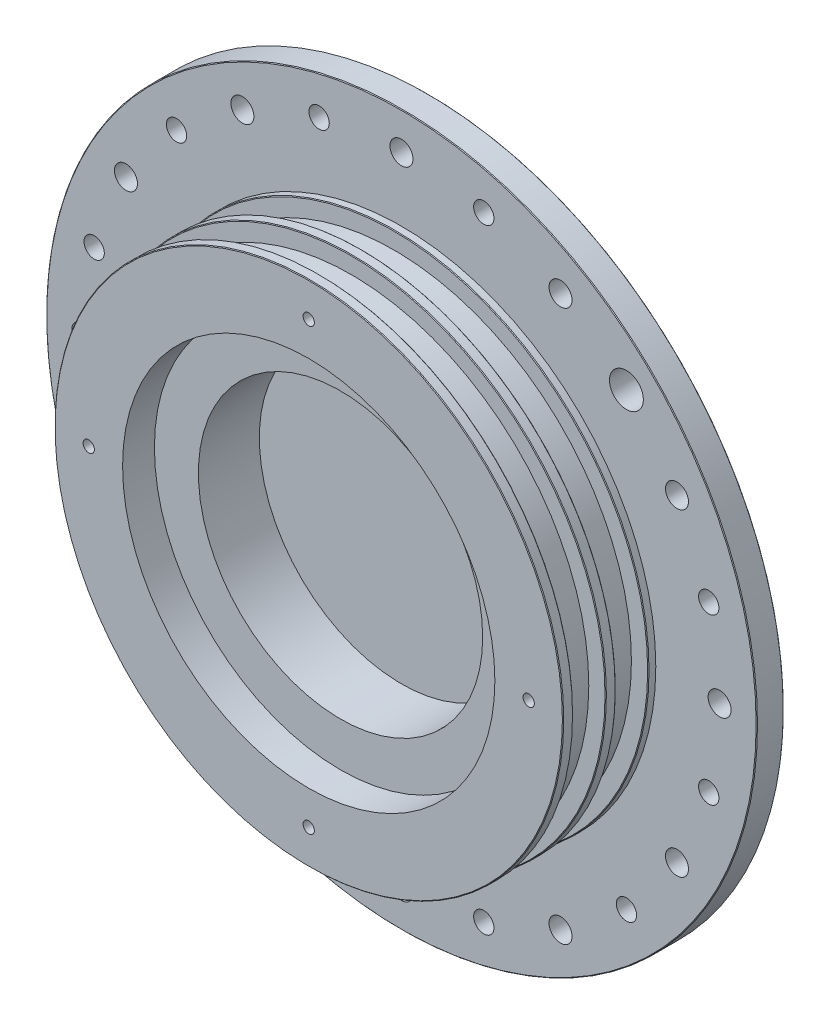
from build123d import *

# Parameters (mm, degrees)
DIAM_TRE_DU_PER_AGE_9_0_9_1_D     = 9
DIAM_TRE_DU_PER_AGE_9_0_9_1_DEPTH = 3
D_GAGEMENT_M31_D                  = 3.332
D_GAGEMENT_M31_DEPTH              = 16
D_GAGEMENT_M31_TIP                = 1.001033791
D_GAGEMENT_M1001_D                = 110
D_GAGEMENT_M1001_DEPTH            = 27.4
ESQUISSE8_R                       = 105
ESQUISSE8_R_2                     = 77.5
BOSS_EXTRU_1_DEPTH                = 8
ESQUISSE9_R                       = 3.4
ENL_V_MAT_EXTRU_1_DEPTH           = 20
ENL_V_MAT_EXTRU_15_DEPTH          = 153.653725798
ENL_V_MAT_EXTRU_15_DEPTH_BACK     = 153.653725798
ESQUISSE24_R                      = 3
ESQUISSE24_R_2                    = 5
CHANFREIN1_SIZE                   = 0.2
ESQUISSE25_R                      = 9.2
ENL_V_MAT_EXTRU_18_DEPTH          = 2
ESQUISSE35_R                      = 55
ESQUISSE35_R_2                    = 42
BOSS_EXTRU_4_DEPTH                = 18
BOSS_EXTRU_5_START                = -4
ESQUISSE36_R                      = 5
BOSS_EXTRU_5_DEPTH                = 4
ESQUISSE9_2_R                     = 3.4
ENL_V_MAT_EXTRU_20_DEPTH          = 20


with BuildPart() as part:
    # Esquisse1 → Révolution1 (revolve)
    with BuildSketch(Plane(origin=(0, 0, 0), x_dir=(1, 0, 0), z_dir=(0, 1, 0))):
        Polygon((87.5, 35.4), (0, 35.4), (0, 0), (75.15, 0), (75.15, 3), (70.15, 3), (70.15, 12.6), (75.15, 12.6), (75.15, 15.6), (70.15, 15.6), (70.15, 25.2), (75.15, 25.2), (75.15, 27.4), (87.5, 27.4), align=None)
    revolve(axis=Axis((0, 0, -35.4), (0, 0, 1)))

    # Diamètre du perçage Ø9.0 (9)1
    with Locations(Plane.XY.offset(-27.4)):
        with Locations((-87.5, 0), (0, 87.5), (0, -87.5), (87.5, 0)):
            Hole(DIAM_TRE_DU_PER_AGE_9_0_9_1_D / 2, depth=DIAM_TRE_DU_PER_AGE_9_0_9_1_DEPTH)

    # Dégagement M31
    with Locations(Plane.XY):
        with Locations((-65, 0), (65, 0), (0, 65), (0, -65)):
            Hole(D_GAGEMENT_M31_D / 2, depth=D_GAGEMENT_M31_DEPTH)
            with Locations((0, 0, -(D_GAGEMENT_M31_DEPTH + D_GAGEMENT_M31_TIP / 2))):  # 118° drill point
                Cone(0, D_GAGEMENT_M31_D / 2, D_GAGEMENT_M31_TIP, mode=Mode.SUBTRACT)

    # Dégagement M1001
    with Locations(Plane.XY):
        with Locations((0, 0)):
            Hole(D_GAGEMENT_M1001_D / 2, depth=D_GAGEMENT_M1001_DEPTH)

    # Esquisse8 → Boss.-Extru.1 (add)
    with BuildSketch(Plane(origin=(0, 0, -35.4), x_dir=(-1, 0, 0), z_dir=(0, 0, -1))):
        Circle(ESQUISSE8_R)
        Circle(ESQUISSE8_R_2, mode=Mode.SUBTRACT)
    extrude(amount=-BOSS_EXTRU_1_DEPTH)

    # Esquisse9 → Enlèv. mat.-Extru.1 (cut)
    with BuildSketch(Plane.XY.offset(-35.4)):
        with Locations((0, -50)):
            Circle(ESQUISSE9_R)
        with Locations((0, -94)):
            Circle(ESQUISSE9_R)
        with Locations((-25, -43.301270189)):
            Circle(ESQUISSE9_R)
        with Locations((-47, -81.406387956)):
            Circle(ESQUISSE9_R)
        with Locations((-43.301270189, -25)):
            Circle(ESQUISSE9_R)
        with Locations((-81.406387956, -47)):
            Circle(ESQUISSE9_R)
        with Locations((-50, 0)):
            Circle(ESQUISSE9_R)
        with Locations((-94, 0)):
            Circle(ESQUISSE9_R)
        with Locations((-43.301270189, 25)):
            Circle(ESQUISSE9_R)
        with Locations((-81.406387956, 47)):
            Circle(ESQUISSE9_R)
        with Locations((-25, 43.301270189)):
            Circle(ESQUISSE9_R)
        with Locations((-47, 81.406387956)):
            Circle(ESQUISSE9_R)
        with Locations((0, 50)):
            Circle(ESQUISSE9_R)
        with Locations((0, 94)):
            Circle(ESQUISSE9_R)
        with Locations((25, 43.301270189)):
            Circle(ESQUISSE9_R)
        with Locations((47, 81.406387956)):
            Circle(ESQUISSE9_R)
        with Locations((43.301270189, 25)):
            Circle(ESQUISSE9_R)
        with Locations((81.406387956, 47)):
            Circle(ESQUISSE9_R)
        with Locations((50, 0)):
            Circle(ESQUISSE9_R)
        with Locations((94, 0)):
            Circle(ESQUISSE9_R)
        with Locations((43.301270189, -25)):
            Circle(ESQUISSE9_R)
        with Locations((81.406387956, -47)):
            Circle(ESQUISSE9_R)
        with Locations((25, -43.301270189)):
            Circle(ESQUISSE9_R)
        with Locations((47, -81.406387956)):
            Circle(ESQUISSE9_R)
    extrude(amount=ENL_V_MAT_EXTRU_1_DEPTH, mode=Mode.SUBTRACT)

    # Esquisse24 → Enlèv. mat.-Extru.15 (cut, two sides: drawn at the far end of the back side and taken through both)
    with BuildSketch(Plane(origin=(0, 0, -35.4), x_dir=(-1, 0, 0), z_dir=(0, 0, -1)).offset(-ENL_V_MAT_EXTRU_15_DEPTH_BACK)):
        with Locations((24.32899024, 90.797027671)):
            Circle(ESQUISSE24_R)
        with Locations((66.468037432, 66.468037432)):
            Circle(ESQUISSE24_R)
        with Locations((90.797027671, 24.32899024)):
            Circle(ESQUISSE24_R)
        with Locations((90.797027671, -24.32899024)):
            Circle(ESQUISSE24_R)
        with Locations((-14, 24.248711306)):
            Circle(ESQUISSE24_R_2)
        with Locations((7.246933263, 27.045923136)):
            Circle(ESQUISSE24_R_2)
        with Locations((24.248711306, 14)):
            Circle(ESQUISSE24_R_2)
        with Locations((27.045923136, -7.246933263)):
            Circle(ESQUISSE24_R_2)
        with Locations((14, -24.248711306)):
            Circle(ESQUISSE24_R_2)
        with Locations((-7.246933263, -27.045923136)):
            Circle(ESQUISSE24_R_2)
        with Locations((-24.248711306, -14)):
            Circle(ESQUISSE24_R_2)
        with Locations((-27.045923136, 7.246933263)):
            Circle(ESQUISSE24_R_2)
        with Locations((-66.468037432, 66.468037432)):
            Circle(ESQUISSE24_R_2)
        with Locations((66.468037432, -66.468037432)):
            Circle(ESQUISSE24_R)
        with Locations((24.32899024, -90.797027671)):
            Circle(ESQUISSE24_R)
        with Locations((-24.32899024, -90.797027671)):
            Circle(ESQUISSE24_R)
        with Locations((-66.468037432, -66.468037432)):
            Circle(ESQUISSE24_R)
        with Locations((-90.797027671, -24.32899024)):
            Circle(ESQUISSE24_R)
        with Locations((-90.797027671, 24.32899024)):
            Circle(ESQUISSE24_R)
        with Locations((-24.32899024, 90.797027671)):
            Circle(ESQUISSE24_R)
        Circle(ESQUISSE24_R_2)
    extrude(amount=ENL_V_MAT_EXTRU_15_DEPTH + ENL_V_MAT_EXTRU_15_DEPTH_BACK, mode=Mode.SUBTRACT)

    # Chanfrein1
    chanfrein1_edges = [part.edges().sort_by_distance(p)[0] for p in [
        (-75.15, 0, -25.2),
        (-75.15, 0, -3),
        (-75.15, 0, -12.6),
        (-75.15, 0, -15.6),
        (105, 0, -35.4),
        (105, 0, -27.4),
        (-75.15, 0, 0),
    ]]
    chamfer(chanfrein1_edges, length=CHANFREIN1_SIZE)

    # Esquisse25 → Enlèv. mat.-Extru.18 (cut)
    with BuildSketch(Plane(origin=(0, 0, -35.4), x_dir=(-1, 0, 0), z_dir=(0, 0, -1))):
        Circle(ESQUISSE25_R)
        with BuildLine():
            Line((-22.534674305, 14.423884843), (-27.364303436, 15.717980069))
            ThreePointArc((-27.364303436, 15.717980069), (-27.626062148, 15.80113362), (-27.879119212, 15.907877515))
            ThreePointArc((-27.879119212, 15.907877515), (-29.43732897, 16.188098003), (-30.921195595, 15.636118826))
            ThreePointArc((-30.921195595, 15.636118826), (-31.100803738, 15.516590499), (-31.288537773, 15.410279455))
            ThreePointArc((-31.288537773, 15.410279455), (-35.932440738, 9.628068478), (-34.801808286, 2.298575399))
            ThreePointArc((-34.801808286, 2.298575399), (-34.692381365, 2.112640317), (-34.596600313, 1.919321678))
            ThreePointArc((-34.596600313, 1.919321678), (-33.587523709, 0.699360376), (-32.09796423, 0.162933558))
            ThreePointArc((-32.09796423, 0.162933558), (-31.825438437, 0.128847951), (-31.557171967, 0.069981683))
            Line((-31.557171967, 0.069981683), (-26.727542836, -1.224113543))
            ThreePointArc((-26.727542836, -1.224113543), (-26.465784124, -1.307267094), (-26.212727061, -1.414010989))
            ThreePointArc((-26.212727061, -1.414010989), (-24.654517302, -1.694231477), (-23.170650678, -1.1422523))
            ThreePointArc((-23.170650678, -1.1422523), (-22.991042534, -1.022723973), (-22.803308499, -0.916412929))
            ThreePointArc((-22.803308499, -0.916412929), (-18.159405534, 4.865798048), (-19.290037986, 12.195291126))
            ThreePointArc((-19.290037986, 12.195291126), (-19.399464908, 12.381226209), (-19.495245959, 12.574544848))
            ThreePointArc((-19.495245959, 12.574544848), (-20.504322564, 13.79450615), (-21.993882042, 14.330932968))
            ThreePointArc((-21.993882042, 14.330932968), (-22.266407835, 14.365018575), (-22.534674305, 14.423884843))
        make_face()
        with BuildLine():
            Line((-5.735194229, 26.133647797), (-8.235194229, 30.463774815))
            ThreePointArc((-8.235194229, 30.463774815), (-8.36148715, 30.707664616), (-8.464946183, 30.962082313))
            ThreePointArc((-8.464946183, 30.962082313), (-9.368621062, 32.262048807), (-10.808181434, 32.92099274))
            ThreePointArc((-10.808181434, 32.92099274), (-11.019702861, 32.963475586), (-11.22762413, 33.021050335))
            ThreePointArc((-11.22762413, 33.021050335), (-18.6, 32.216145021), (-22.983256384, 26.233932888))
            ThreePointArc((-22.983256384, 26.233932888), (-23.037355824, 26.025080413), (-23.106325314, 25.820656061))
            ThreePointArc((-23.106325314, 25.820656061), (-23.255443313, 24.244488242), (-22.581476746, 22.811899593))
            ThreePointArc((-22.581476746, 22.811899593), (-22.412874073, 22.595092593), (-22.264805771, 22.363774815))
            Line((-22.264805771, 22.363774815), (-19.764805771, 18.033647797))
            ThreePointArc((-19.764805771, 18.033647797), (-19.63851285, 17.789757996), (-19.535053817, 17.535340299))
            ThreePointArc((-19.535053817, 17.535340299), (-18.631378938, 16.235373805), (-17.191818566, 15.576429871))
            ThreePointArc((-17.191818566, 15.576429871), (-16.980297139, 15.533947026), (-16.77237587, 15.476372277))
            ThreePointArc((-16.77237587, 15.476372277), (-9.4, 16.281277591), (-5.016743616, 22.263489724))
            ThreePointArc((-5.016743616, 22.263489724), (-4.962644176, 22.472342199), (-4.893674686, 22.676766551))
            ThreePointArc((-4.893674686, 22.676766551), (-4.744556687, 24.25293437), (-5.418523254, 25.685523019))
            ThreePointArc((-5.418523254, 25.685523019), (-5.587125927, 25.902330019), (-5.735194229, 26.133647797))
        make_face()
        with BuildLine():
            Line((14.423884843, 22.534674305), (15.717980069, 27.364303436))
            ThreePointArc((15.717980069, 27.364303436), (15.80113362, 27.626062148), (15.907877515, 27.879119212))
            ThreePointArc((15.907877515, 27.879119212), (16.188098003, 29.43732897), (15.636118826, 30.921195595))
            ThreePointArc((15.636118826, 30.921195595), (15.516590499, 31.100803738), (15.410279455, 31.288537773))
            ThreePointArc((15.410279455, 31.288537773), (9.628068478, 35.932440738), (2.298575399, 34.801808286))
            ThreePointArc((2.298575399, 34.801808286), (2.112640317, 34.692381365), (1.919321678, 34.596600313))
            ThreePointArc((1.919321678, 34.596600313), (0.699360376, 33.587523709), (0.162933558, 32.09796423))
            ThreePointArc((0.162933558, 32.09796423), (0.128847951, 31.825438437), (0.069981683, 31.557171967))
            Line((0.069981683, 31.557171967), (-1.224113543, 26.727542836))
            ThreePointArc((-1.224113543, 26.727542836), (-1.307267094, 26.465784124), (-1.414010989, 26.212727061))
            ThreePointArc((-1.414010989, 26.212727061), (-1.694231477, 24.654517302), (-1.1422523, 23.170650678))
            ThreePointArc((-1.1422523, 23.170650678), (-1.022723973, 22.991042534), (-0.916412929, 22.803308499))
            ThreePointArc((-0.916412929, 22.803308499), (4.865798048, 18.159405534), (12.195291126, 19.290037986))
            ThreePointArc((12.195291126, 19.290037986), (12.381226209, 19.399464908), (12.574544848, 19.495245959))
            ThreePointArc((12.574544848, 19.495245959), (13.79450615, 20.504322564), (14.330932968, 21.993882042))
            ThreePointArc((14.330932968, 21.993882042), (14.365018575, 22.266407835), (14.423884843, 22.534674305))
        make_face()
        with BuildLine():
            Line((26.133647797, 5.735194229), (30.463774815, 8.235194229))
            ThreePointArc((30.463774815, 8.235194229), (30.707664616, 8.36148715), (30.962082313, 8.464946183))
            ThreePointArc((30.962082313, 8.464946183), (32.262048807, 9.368621062), (32.92099274, 10.808181434))
            ThreePointArc((32.92099274, 10.808181434), (32.963475586, 11.019702861), (33.021050335, 11.22762413))
            ThreePointArc((33.021050335, 11.22762413), (32.216145021, 18.6), (26.233932888, 22.983256384))
            ThreePointArc((26.233932888, 22.983256384), (26.025080413, 23.037355824), (25.820656061, 23.106325314))
            ThreePointArc((25.820656061, 23.106325314), (24.244488242, 23.255443313), (22.811899593, 22.581476746))
            ThreePointArc((22.811899593, 22.581476746), (22.595092593, 22.412874073), (22.363774815, 22.264805771))
            Line((22.363774815, 22.264805771), (18.033647797, 19.764805771))
            ThreePointArc((18.033647797, 19.764805771), (17.789757996, 19.63851285), (17.535340299, 19.535053817))
            ThreePointArc((17.535340299, 19.535053817), (16.235373805, 18.631378938), (15.576429871, 17.191818566))
            ThreePointArc((15.576429871, 17.191818566), (15.533947026, 16.980297139), (15.476372277, 16.77237587))
            ThreePointArc((15.476372277, 16.77237587), (16.281277591, 9.4), (22.263489724, 5.016743616))
            ThreePointArc((22.263489724, 5.016743616), (22.472342199, 4.962644176), (22.676766551, 4.893674686))
            ThreePointArc((22.676766551, 4.893674686), (24.25293437, 4.744556687), (25.685523019, 5.418523254))
            ThreePointArc((25.685523019, 5.418523254), (25.902330019, 5.587125927), (26.133647797, 5.735194229))
        make_face()
        with BuildLine():
            Line((22.534674305, -14.423884843), (27.364303436, -15.717980069))
            ThreePointArc((27.364303436, -15.717980069), (27.626062148, -15.80113362), (27.879119212, -15.907877515))
            ThreePointArc((27.879119212, -15.907877515), (29.43732897, -16.188098003), (30.921195595, -15.636118826))
            ThreePointArc((30.921195595, -15.636118826), (31.100803738, -15.516590499), (31.288537773, -15.410279455))
            ThreePointArc((31.288537773, -15.410279455), (35.932440738, -9.628068478), (34.801808286, -2.298575399))
            ThreePointArc((34.801808286, -2.298575399), (34.692381365, -2.112640317), (34.596600313, -1.919321678))
            ThreePointArc((34.596600313, -1.919321678), (33.587523709, -0.699360376), (32.09796423, -0.162933558))
            ThreePointArc((32.09796423, -0.162933558), (31.825438437, -0.128847951), (31.557171967, -0.069981683))
            Line((31.557171967, -0.069981683), (26.727542836, 1.224113543))
            ThreePointArc((26.727542836, 1.224113543), (26.465784124, 1.307267094), (26.212727061, 1.414010989))
            ThreePointArc((26.212727061, 1.414010989), (24.654517302, 1.694231477), (23.170650678, 1.1422523))
            ThreePointArc((23.170650678, 1.1422523), (22.991042534, 1.022723973), (22.803308499, 0.916412929))
            ThreePointArc((22.803308499, 0.916412929), (18.159405534, -4.865798048), (19.290037986, -12.195291126))
            ThreePointArc((19.290037986, -12.195291126), (19.399464908, -12.381226209), (19.495245959, -12.574544848))
            ThreePointArc((19.495245959, -12.574544848), (20.504322564, -13.79450615), (21.993882042, -14.330932968))
            ThreePointArc((21.993882042, -14.330932968), (22.266407835, -14.365018575), (22.534674305, -14.423884843))
        make_face()
        with BuildLine():
            Line((5.735194229, -26.133647797), (8.235194229, -30.463774815))
            ThreePointArc((8.235194229, -30.463774815), (8.36148715, -30.707664616), (8.464946183, -30.962082313))
            ThreePointArc((8.464946183, -30.962082313), (9.368621062, -32.262048807), (10.808181434, -32.92099274))
            ThreePointArc((10.808181434, -32.92099274), (11.019702861, -32.963475586), (11.22762413, -33.021050335))
            ThreePointArc((11.22762413, -33.021050335), (18.6, -32.216145021), (22.983256384, -26.233932888))
            ThreePointArc((22.983256384, -26.233932888), (23.037355824, -26.025080413), (23.106325314, -25.820656061))
            ThreePointArc((23.106325314, -25.820656061), (23.255443313, -24.244488242), (22.581476746, -22.811899593))
            ThreePointArc((22.581476746, -22.811899593), (22.412874073, -22.595092593), (22.264805771, -22.363774815))
            Line((22.264805771, -22.363774815), (19.764805771, -18.033647797))
            ThreePointArc((19.764805771, -18.033647797), (19.63851285, -17.789757996), (19.535053817, -17.535340299))
            ThreePointArc((19.535053817, -17.535340299), (18.631378938, -16.235373805), (17.191818566, -15.576429871))
            ThreePointArc((17.191818566, -15.576429871), (16.980297139, -15.533947026), (16.77237587, -15.476372277))
            ThreePointArc((16.77237587, -15.476372277), (9.4, -16.281277591), (5.016743616, -22.263489724))
            ThreePointArc((5.016743616, -22.263489724), (4.962644176, -22.472342199), (4.893674686, -22.676766551))
            ThreePointArc((4.893674686, -22.676766551), (4.744556687, -24.25293437), (5.418523254, -25.685523019))
            ThreePointArc((5.418523254, -25.685523019), (5.587125927, -25.902330019), (5.735194229, -26.133647797))
        make_face()
        with BuildLine():
            Line((-14.423884843, -22.534674305), (-15.717980069, -27.364303436))
            ThreePointArc((-15.717980069, -27.364303436), (-15.80113362, -27.626062148), (-15.907877515, -27.879119212))
            ThreePointArc((-15.907877515, -27.879119212), (-16.188098003, -29.43732897), (-15.636118826, -30.921195595))
            ThreePointArc((-15.636118826, -30.921195595), (-15.516590499, -31.100803738), (-15.410279455, -31.288537773))
            ThreePointArc((-15.410279455, -31.288537773), (-9.628068478, -35.932440738), (-2.298575399, -34.801808286))
            ThreePointArc((-2.298575399, -34.801808286), (-2.112640317, -34.692381365), (-1.919321678, -34.596600313))
            ThreePointArc((-1.919321678, -34.596600313), (-0.699360376, -33.587523709), (-0.162933558, -32.09796423))
            ThreePointArc((-0.162933558, -32.09796423), (-0.128847951, -31.825438437), (-0.069981683, -31.557171967))
            Line((-0.069981683, -31.557171967), (1.224113543, -26.727542836))
            ThreePointArc((1.224113543, -26.727542836), (1.307267094, -26.465784124), (1.414010989, -26.212727061))
            ThreePointArc((1.414010989, -26.212727061), (1.694231477, -24.654517302), (1.1422523, -23.170650678))
            ThreePointArc((1.1422523, -23.170650678), (1.022723973, -22.991042534), (0.916412929, -22.803308499))
            ThreePointArc((0.916412929, -22.803308499), (-4.865798048, -18.159405534), (-12.195291126, -19.290037986))
            ThreePointArc((-12.195291126, -19.290037986), (-12.381226209, -19.399464908), (-12.574544848, -19.495245959))
            ThreePointArc((-12.574544848, -19.495245959), (-13.79450615, -20.504322564), (-14.330932968, -21.993882042))
            ThreePointArc((-14.330932968, -21.993882042), (-14.365018575, -22.266407835), (-14.423884843, -22.534674305))
        make_face()
        with BuildLine():
            Line((-26.133647797, -5.735194229), (-30.463774815, -8.235194229))
            ThreePointArc((-30.463774815, -8.235194229), (-30.707664616, -8.36148715), (-30.962082313, -8.464946183))
            ThreePointArc((-30.962082313, -8.464946183), (-32.262048807, -9.368621062), (-32.92099274, -10.808181434))
            ThreePointArc((-32.92099274, -10.808181434), (-32.963475586, -11.019702861), (-33.021050335, -11.22762413))
            ThreePointArc((-33.021050335, -11.22762413), (-32.216145021, -18.6), (-26.233932888, -22.983256384))
            ThreePointArc((-26.233932888, -22.983256384), (-26.025080413, -23.037355824), (-25.820656061, -23.106325314))
            ThreePointArc((-25.820656061, -23.106325314), (-24.244488242, -23.255443313), (-22.811899593, -22.581476746))
            ThreePointArc((-22.811899593, -22.581476746), (-22.595092593, -22.412874073), (-22.363774815, -22.264805771))
            Line((-22.363774815, -22.264805771), (-18.033647797, -19.764805771))
            ThreePointArc((-18.033647797, -19.764805771), (-17.789757996, -19.63851285), (-17.535340299, -19.535053817))
            ThreePointArc((-17.535340299, -19.535053817), (-16.235373805, -18.631378938), (-15.576429871, -17.191818566))
            ThreePointArc((-15.576429871, -17.191818566), (-15.533947026, -16.980297139), (-15.476372277, -16.77237587))
            ThreePointArc((-15.476372277, -16.77237587), (-16.281277591, -9.4), (-22.263489724, -5.016743616))
            ThreePointArc((-22.263489724, -5.016743616), (-22.472342199, -4.962644176), (-22.676766551, -4.893674686))
            ThreePointArc((-22.676766551, -4.893674686), (-24.25293437, -4.744556687), (-25.685523019, -5.418523254))
            ThreePointArc((-25.685523019, -5.418523254), (-25.902330019, -5.587125927), (-26.133647797, -5.735194229))
        make_face()
    extrude(amount=-ENL_V_MAT_EXTRU_18_DEPTH, mode=Mode.SUBTRACT)

    # Esquisse35 → Boss.-Extru.4 (add)
    with BuildSketch(Plane.XY.offset(-27.4)):
        Circle(ESQUISSE35_R)
        Circle(ESQUISSE35_R_2, mode=Mode.SUBTRACT)
    extrude(amount=BOSS_EXTRU_4_DEPTH)

    # Esquisse36 → Boss.-Extru.5 (add)
    with BuildSketch(Plane.XY.offset(-27.4).offset(BOSS_EXTRU_5_START)):
        with Locations((-27.045923136, -7.246933263)):
            Circle(ESQUISSE36_R)
        with Locations((-24.248711306, 14)):
            Circle(ESQUISSE36_R)
        with Locations((-7.246933263, 27.045923136)):
            Circle(ESQUISSE36_R)
        with Locations((14, 24.248711306)):
            Circle(ESQUISSE36_R)
        with Locations((27.045923136, 7.246933263)):
            Circle(ESQUISSE36_R)
        with Locations((24.248711306, -14)):
            Circle(ESQUISSE36_R)
        with Locations((7.246933263, -27.045923136)):
            Circle(ESQUISSE36_R)
        with Locations((-14, -24.248711306)):
            Circle(ESQUISSE36_R)
        Circle(ESQUISSE36_R)
    extrude(amount=BOSS_EXTRU_5_DEPTH)

    # Esquisse9<2> → Enlèv. mat.-Extru.20 (cut)
    with BuildSketch(Plane.XY.offset(-35.4)):
        with Locations((0, -50)):
            Circle(ESQUISSE9_2_R)
        with Locations((0, -94)):
            Circle(ESQUISSE9_2_R)
        with Locations((-25, -43.301270189)):
            Circle(ESQUISSE9_2_R)
        with Locations((-47, -81.406387956)):
            Circle(ESQUISSE9_2_R)
        with Locations((-43.301270189, -25)):
            Circle(ESQUISSE9_2_R)
        with Locations((-81.406387956, -47)):
            Circle(ESQUISSE9_2_R)
        with Locations((-50, 0)):
            Circle(ESQUISSE9_2_R)
        with Locations((-94, 0)):
            Circle(ESQUISSE9_2_R)
        with Locations((-43.301270189, 25)):
            Circle(ESQUISSE9_2_R)
        with Locations((-81.406387956, 47)):
            Circle(ESQUISSE9_2_R)
        with Locations((-25, 43.301270189)):
            Circle(ESQUISSE9_2_R)
        with Locations((-47, 81.406387956)):
            Circle(ESQUISSE9_2_R)
        with Locations((0, 50)):
            Circle(ESQUISSE9_2_R)
        with Locations((0, 94)):
            Circle(ESQUISSE9_2_R)
        with Locations((25, 43.301270189)):
            Circle(ESQUISSE9_2_R)
        with Locations((47, 81.406387956)):
            Circle(ESQUISSE9_2_R)
        with Locations((43.301270189, 25)):
            Circle(ESQUISSE9_2_R)
        with Locations((81.406387956, 47)):
            Circle(ESQUISSE9_2_R)
        with Locations((50, 0)):
            Circle(ESQUISSE9_2_R)
        with Locations((94, 0)):
            Circle(ESQUISSE9_2_R)
        with Locations((43.301270189, -25)):
            Circle(ESQUISSE9_2_R)
        with Locations((81.406387956, -47)):
            Circle(ESQUISSE9_2_R)
        with Locations((25, -43.301270189)):
            Circle(ESQUISSE9_2_R)
        with Locations((47, -81.406387956)):
            Circle(ESQUISSE9_2_R)
    extrude(amount=ENL_V_MAT_EXTRU_20_DEPTH, mode=Mode.SUBTRACT)


solid = part.part
